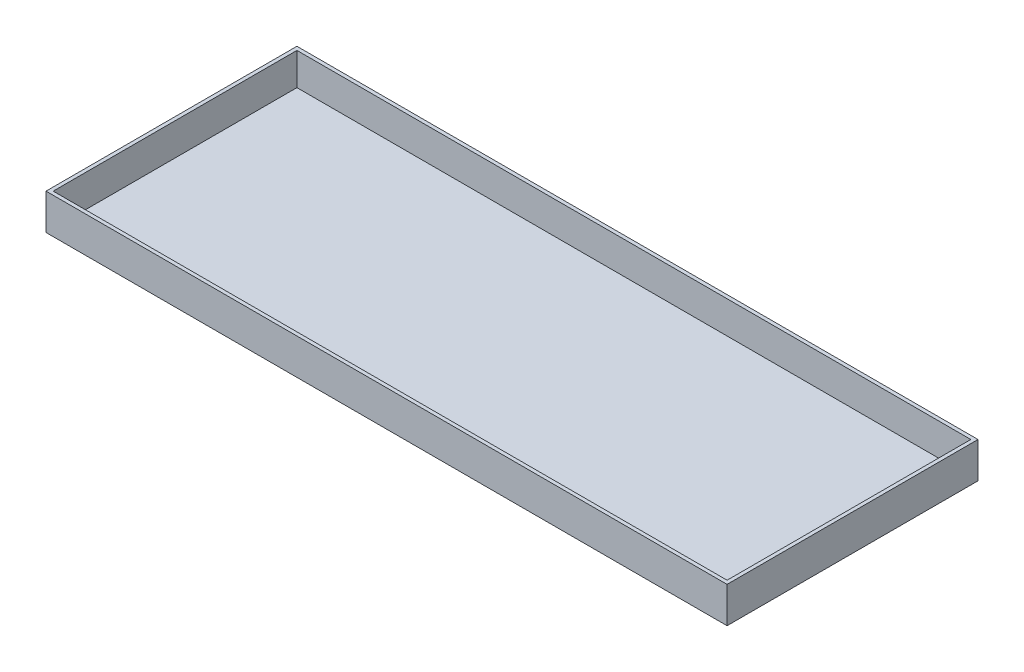
from build123d import *

# Parameters (mm, degrees)
SKIZZE1_W                       = 350
SKIZZE1_H                       = 50
AUFSATZ_LINEAR_AUSTRAGEN1_DEPTH = 950
SKIZZE2_W                       = 940
SKIZZE2_H                       = 340
SCHNITT_LINEAR_AUSTRAGEN1_DEPTH = 45


with BuildPart() as part:
    # Skizze1 → Aufsatz-Linear austragen1 (new body)
    with BuildSketch(Plane(origin=(0, 0, 0), x_dir=(0, 0, -1), z_dir=(1, 0, 0))):
        with Locations((175, 25)):
            Rectangle(SKIZZE1_W, SKIZZE1_H)
    extrude(amount=AUFSATZ_LINEAR_AUSTRAGEN1_DEPTH)

    # Skizze2 → Schnitt-Linear austragen1 (cut)
    with BuildSketch(Plane(origin=(0, 50, 0), x_dir=(1, 0, 0), z_dir=(0, 1, 0))):
        with Locations((475, 175)):
            Rectangle(SKIZZE2_W, SKIZZE2_H)
    extrude(amount=-SCHNITT_LINEAR_AUSTRAGEN1_DEPTH, mode=Mode.SUBTRACT)


solid = part.part
